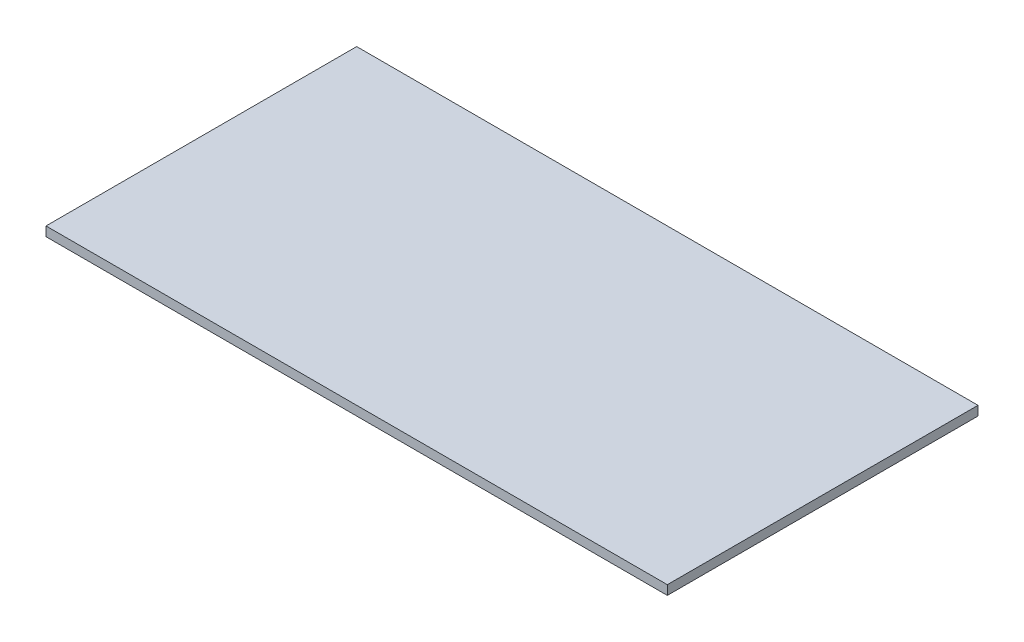
from build123d import *

# Parameters (mm, degrees)
SKETCH1_W           = 200
SKETCH1_H           = 100
BOSS_EXTRUDE1_DEPTH = 3


with BuildPart() as part:
    # Sketch1 → Boss-Extrude1 (new body)
    with BuildSketch(Plane(origin=(0, 0, 0), x_dir=(1, 0, 0), z_dir=(0, 1, 0))):
        Rectangle(SKETCH1_W, SKETCH1_H)
    extrude(amount=BOSS_EXTRUDE1_DEPTH)


solid = part.part
